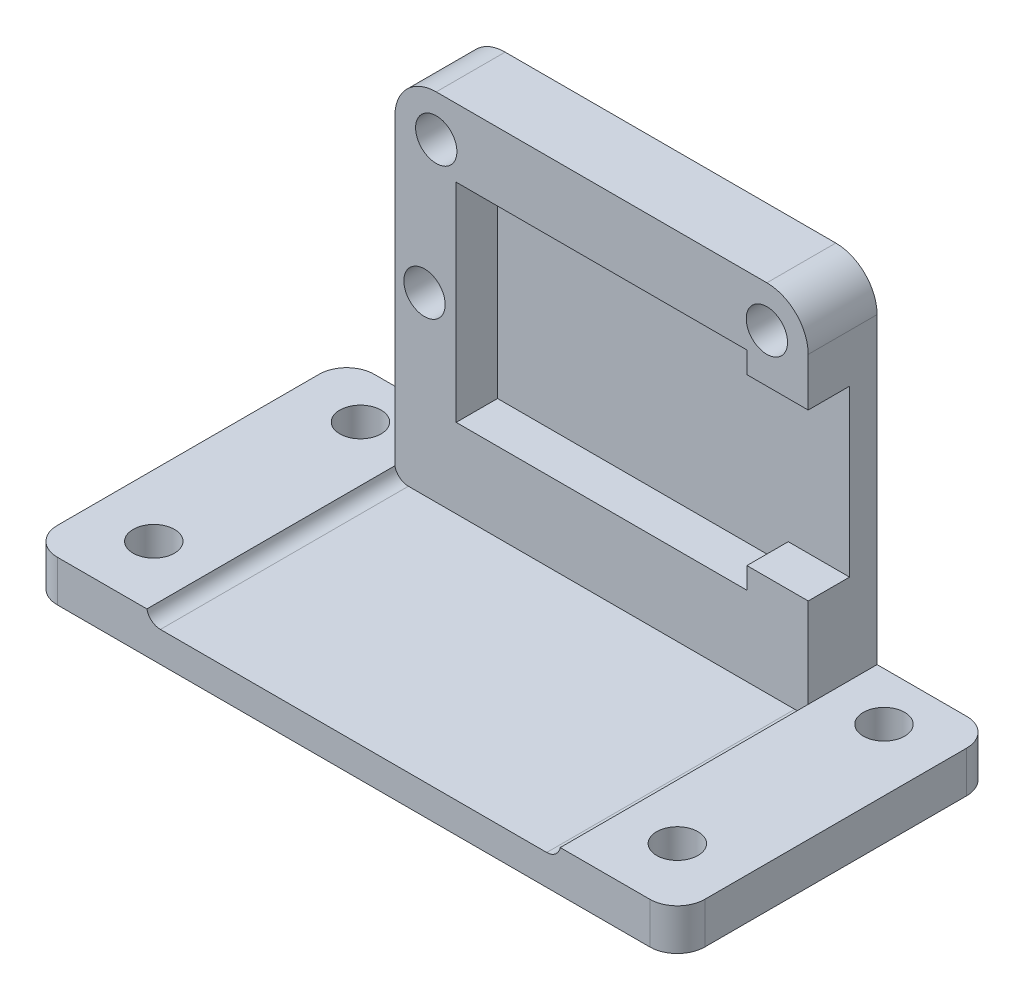
from build123d import *

# Parameters (mm, degrees)
SKETCH_1_W          = 30
SKETCH_1_H          = 25
EXTRUDE_1_DEPTH     = 5
SKETCH_2_W          = 21.1
SKETCH_2_H          = 15.1
CUT_EXTRUDE_1_DEPTH = 3
SKETCH_3_W          = 4.45
SKETCH_3_H          = 12
CUT_EXTRUDE_2_DEPTH = 3
FILLET_3_R          = 3
SKETCH_8_R          = 1.5
CUT_EXTRUDE_6_DEPTH = 10
SKETCH_9_W          = 47
SKETCH_9_H          = 23
EXTRUDE_2_DEPTH     = 3
SKETCH_10_R         = 1.5
CUT_EXTRUDE_7_DEPTH = 42.306779105
FILLET_4_R          = 2
SKETCH_11_W         = 30
SKETCH_11_H         = 0.8
CUT_EXTRUDE_8_DEPTH = 18
FILLET_5_R          = 1


with BuildPart() as part:
    # 草图1 → 凸台-拉伸1 (new body)
    with BuildSketch(Plane.XY):
        Rectangle(SKETCH_1_W, SKETCH_1_H)
    extrude(amount=EXTRUDE_1_DEPTH)

    # 草图2 → 切除-拉伸1 (cut)
    with BuildSketch(Plane.XY.offset(5)):
        Rectangle(SKETCH_2_W, SKETCH_2_H)
    extrude(amount=-CUT_EXTRUDE_1_DEPTH, mode=Mode.SUBTRACT)

    # 草图3 → 切除-拉伸2 (cut)
    with BuildSketch(Plane.XY.offset(5)):
        with Locations((12.775, 0)):
            Rectangle(SKETCH_3_W, SKETCH_3_H)
    extrude(amount=-CUT_EXTRUDE_2_DEPTH, mode=Mode.SUBTRACT)

    # 圆角3
    fillet_3_edges = [part.edges().sort_by_distance(p)[0] for p in [
        (-15, 12.5, 2.5),
        (15, 12.5, 2.5),
    ]]
    fillet(fillet_3_edges, radius=FILLET_3_R)

    # 草图8 → 切除-拉伸6 (cut, symmetric)
    with BuildSketch(Plane.XY.offset(2)):
        with Locations((12, 9.5)):
            Circle(SKETCH_8_R)
        with Locations((-12, 9.5)):
            Circle(SKETCH_8_R)
        with Locations((-12.85, -0.55)):
            Circle(SKETCH_8_R)
    extrude(amount=CUT_EXTRUDE_6_DEPTH, both=True, mode=Mode.SUBTRACT)

    # 草图9 → 凸台-拉伸2 (add)
    with BuildSketch(Plane.XZ.offset(12.5)):
        with Locations((0, 11.5)):
            Rectangle(SKETCH_9_W, SKETCH_9_H)
    extrude(amount=EXTRUDE_2_DEPTH)

    # 草图10 → 切除-拉伸7 (cut, through all)
    with BuildSketch(Plane(origin=(0, -12.5, 0), x_dir=(1, 0, 0), z_dir=(0, 1, 0))):
        with Locations(Location((-19, -3.5, 0), (0, 0, 180))):
            Circle(SKETCH_10_R)
        with Locations(Location((19, -3.5, 0), (0, 0, 180))):
            Circle(SKETCH_10_R)
        with Locations(Location((-19, -18.5, 0), (0, 0, 180))):
            Circle(SKETCH_10_R)
        with Locations(Location((19, -18.5, 0), (0, 0, 180))):
            Circle(SKETCH_10_R)
    extrude(amount=-CUT_EXTRUDE_7_DEPTH, mode=Mode.SUBTRACT)

    # 圆角4
    fillet_4_edges = [part.edges().sort_by_distance(p)[0] for p in [
        (-23.5, -14, 23),
        (-23.5, -14, 0),
        (23.5, -14, 0),
        (23.5, -14, 23),
    ]]
    fillet(fillet_4_edges, radius=FILLET_4_R)

    # 草图11 → 切除-拉伸8 (cut)
    with BuildSketch(Plane.XY.offset(23)):
        with Locations((0, -12.9)):
            Rectangle(SKETCH_11_W, SKETCH_11_H)
    extrude(amount=-CUT_EXTRUDE_8_DEPTH, mode=Mode.SUBTRACT)

    # 圆角5
    # the kernel refuses this fillet: 1 mm, written as the material it adds along each edge
    with BuildSketch(Plane(origin=(15, -13.3, 23), x_dir=(-1.569855356819468e-12, 1.0, 0), z_dir=(0, 0, -1))) as fillet_5_piece_1:
        with BuildLine():
            CenterArc((1, -0.979795897), FILLET_5_R, 101.536959033, 78.463040967)
            Line((0, -0.979795897), (-0.02, -0.979795897))
            Line((-0.02, -0.979795897), (-0.02, 0))
            Line((-0.02, 0), (0, 0.02))
            ThreePointArc((0, 0.02), (0.4, 0.02), (0.796, 0.019595918))
            Line((0.796, 0.019595918), (0.8, 0))
        make_face()
    extrude(amount=20.449489743)
    with BuildSketch(Plane(origin=(-15, -13.3, 23), x_dir=(1.5720758028687176e-12, 1.0, 0), z_dir=(0, 0, -1))) as fillet_5_piece_2:
        with BuildLine():
            CenterArc((1, 0.979795897), FILLET_5_R, 180, 78.463040967)
            Line((0, 0.979795897), (-0.02, 0.979795897))
            Line((-0.02, 0.979795897), (-0.02, 0))
            Line((-0.02, 0), (0, -0.02))
            ThreePointArc((0, -0.02), (0.4, -0.02), (0.796, -0.019595918))
            Line((0.796, -0.019595918), (0.8, 0))
        make_face()
    extrude(amount=20.449489743)


solid = part.part
